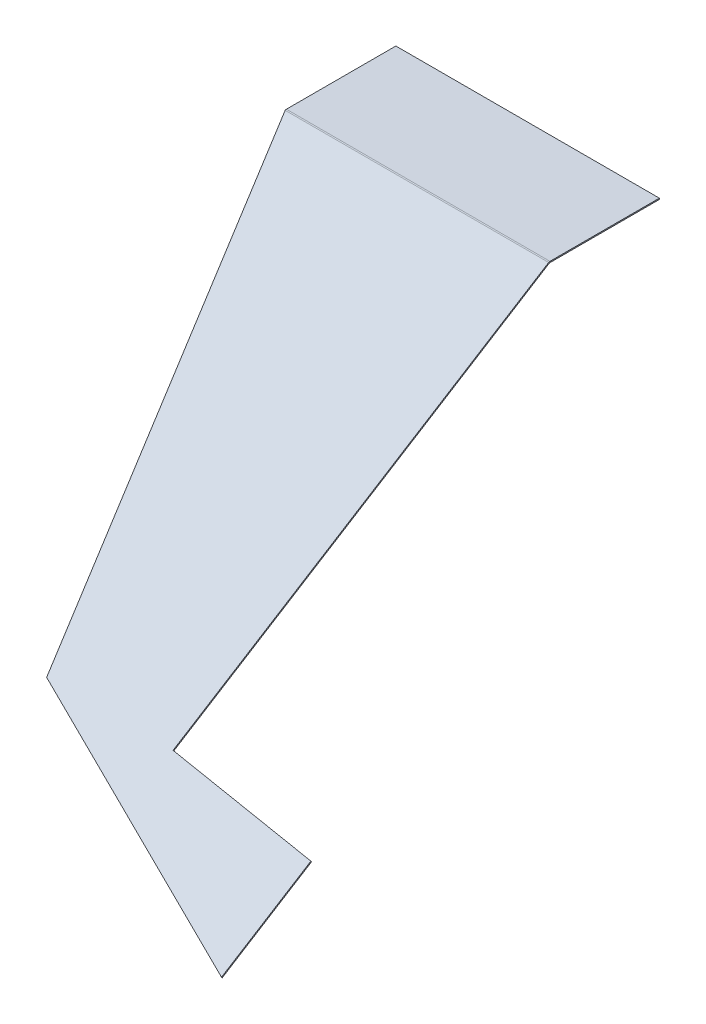
from build123d import *

# Parameters (mm, degrees)
SKETCH1_W                    = 180
SKETCH1_H                    = 75
BASE_FLANGE1_DEPTH           = 0.8
EDGE_FLANGE1_STRIP_CUT_DEPTH = 180
EDGE_FLANGE1_DEPTH           = 180
CUT_EXTRUDE1_DEPTH           = 10
TAB1_DEPTH                   = 0.8


# Sheet-metal steps are written as plain solids
with BuildPart() as part:
    # Sketch1 → Base-Flange1 (new body)
    with BuildSketch(Plane(origin=(0, 0, 0), x_dir=(1, 0, 0), z_dir=(0, 1, 0))):
        Rectangle(SKETCH1_W, SKETCH1_H)
    extrude(amount=-BASE_FLANGE1_DEPTH)

    # Edge-Flange1 strip (across the edge) → Edge-Flange1 strip cut (cut)
    with BuildSketch(Plane(origin=(90, -0.8, 37.5), x_dir=(0, -0.8480480961564291, -0.5299192642332), z_dir=(-1, 0, 0))):
        Polygon((-3.100489422, 3.452156347), (-0.556876954, -0.618474514), (0.121561523, -0.194539103), (-2.422050945, 3.876091759), align=None)
    extrude(amount=EDGE_FLANGE1_STRIP_CUT_DEPTH, mode=Mode.SUBTRACT)

    # Edge-Flange1 section (across the edge) → Edge-Flange1 (add)
    with BuildSketch(Plane(origin=(90, -0.8, 37.5), x_dir=(0, -0.8480480961564291, -0.5299192642332), z_dir=(-1, 0, 0))):
        with BuildLine():
            Line((-0.8, 0.229396309), (-0.8, 302.770603691))
            Line((-0.8, 302.770603691), (0, 302.770603691))
            Line((0, 302.770603691), (0, 0.229396309))
            ThreePointArc((0, 0.229396309), (0.030990643, 0.008886424), (0.121561523, -0.194539103))
            Line((0.121561523, -0.194539103), (-0.556876954, -0.618474514))
            ThreePointArc((-0.556876954, -0.618474514), (-0.738018714, -0.211623461), (-0.8, 0.229396309))
        make_face()
    extrude(amount=EDGE_FLANGE1_DEPTH)

    # Sketch5 → Cut-Extrude1 (cut)
    with BuildSketch(Plane(origin=(0, 16.955478386, 10.594958791), x_dir=(1, 0, 0), z_dir=(0, 0.8480480961564291, 0.5299192642332))):
        Polygon((-90, -32.455135326), (11.580249487, -360.607900661), (-238.910363798, -331.986176437), align=None)
    extrude(amount=-CUT_EXTRUDE1_DEPTH, mode=Mode.SUBTRACT)

    # Sketch6 → Tab1 (add)
    with BuildSketch(Plane(origin=(0, 16.955478386, 10.594958791), x_dir=(1, 0, 0), z_dir=(0, 0.8480480961564291, 0.5299192642332001))):
        Polygon((3.65214794, -334.996342709), (195.49906109, -420.380554221), (195.49906109, -348.383732857), (90, -334.996342709), align=None)
    extrude(amount=-TAB1_DEPTH)


solid = part.part
